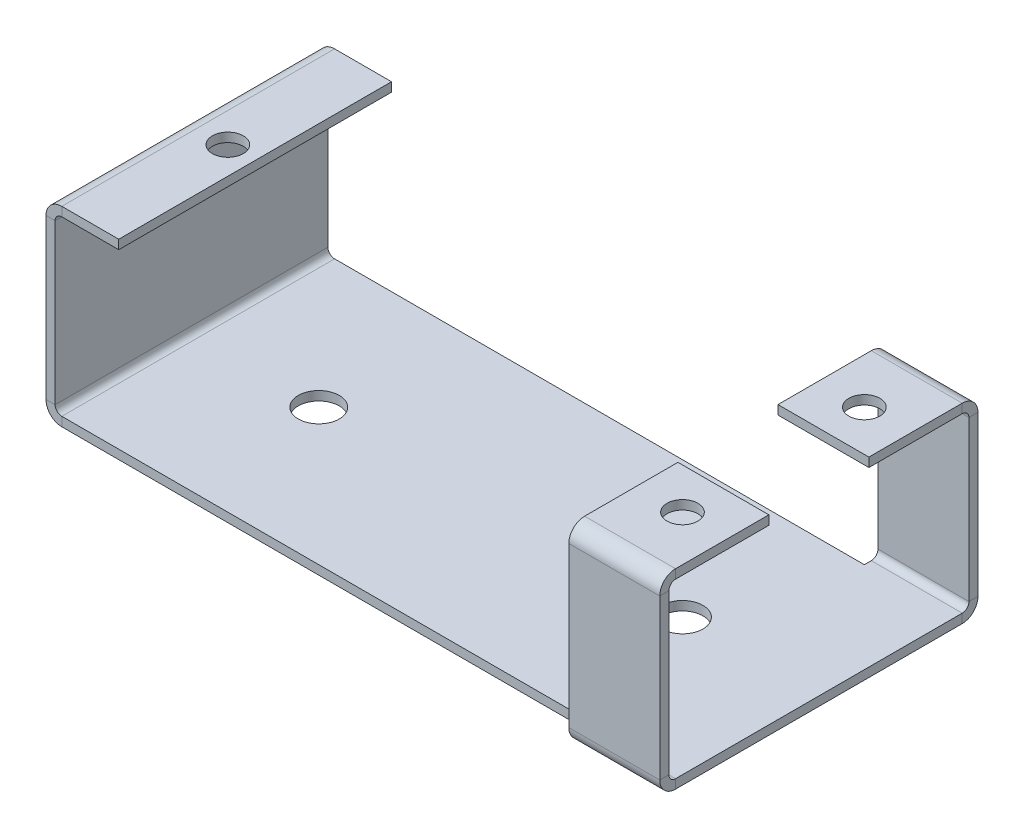
from build123d import *

# Parameters (mm, degrees)
T_LE_DE_BASE_PLI_E1_DEPTH               = 1
T_LE_PLI_E_SUR_AR_TE1_STRIP_W           = 5.4732
T_LE_PLI_E_SUR_AR_TE1_STRIP_H           = 1
T_LE_PLI_E_SUR_AR_TE1_STRIP_CUT_DEPTH   = 30
T_LE_PLI_E_SUR_AR_TE1_DEPTH             = 30
T_LE_PLI_E_SUR_AR_TE2_STRIP_W           = 5.4732
T_LE_PLI_E_SUR_AR_TE2_STRIP_H           = 1
T_LE_PLI_E_SUR_AR_TE2_STRIP_CUT_DEPTH   = 30
T_LE_PLI_E_SUR_AR_TE2_DEPTH             = 30
ENL_V_MAT_EXTRU_1_REACH                 = 46.026
ESQUISSE12_R                            = 1.7
ENL_V_MAT_EXTRU_3_REACH                 = 45.557
ESQUISSE27_R                            = 2.25
T_LE_PLI_E_SUR_AR_TE3_STRIP_W           = 5.4732
T_LE_PLI_E_SUR_AR_TE3_STRIP_H           = 1
T_LE_PLI_E_SUR_AR_TE3_STRIP_CUT_DEPTH   = 10
T_LE_PLI_E_SUR_AR_TE3_STRIP_2_W         = 5.4732
T_LE_PLI_E_SUR_AR_TE3_STRIP_2_H         = 1
T_LE_PLI_E_SUR_AR_TE3_STRIP_CUT_2_DEPTH = 10
T_LE_PLI_E_SUR_AR_TE3_DEPTH             = 10
T_LE_PLI_E_SUR_AR_TE3_BEND_DEPTH        = 10
T_LE_PLI_E_SUR_AR_TE4_STRIP_W           = 5.4732
T_LE_PLI_E_SUR_AR_TE4_STRIP_H           = 1
T_LE_PLI_E_SUR_AR_TE4_STRIP_CUT_DEPTH   = 10
T_LE_PLI_E_SUR_AR_TE4_STRIP_2_W         = 5.4732
T_LE_PLI_E_SUR_AR_TE4_STRIP_2_H         = 1
T_LE_PLI_E_SUR_AR_TE4_STRIP_CUT_2_DEPTH = 10
T_LE_PLI_E_SUR_AR_TE4_DEPTH             = 10
T_LE_PLI_E_SUR_AR_TE4_BEND_DEPTH        = 10
ENL_V_MAT_EXTRU_2_REACH                 = 46.41
ESQUISSE26_R                            = 1.7


# Sheet-metal steps are written as plain solids
with BuildPart() as part:
    # Esquisse1 → Tôle de base pliée1 (new body)
    with BuildSketch(Plane(origin=(0, 0, 0), x_dir=(1, 0, 0), z_dir=(0, 1, 0))):
        Polygon((35, -15), (35, -16.5), (25, -16.5), (25, -15), (-35, -15), (-35, 15), (25, 15), (25, 16.5), (35, 16.5), (35, 15), align=None)
    extrude(amount=T_LE_DE_BASE_PLI_E1_DEPTH)

    # Tôle pliée sur arête1 strip (across the edge) → Tôle pliée sur arête1 strip cut (cut)
    with BuildSketch(Plane(origin=(-35, 1, -15), x_dir=(1, 0, 0), z_dir=(0, 0, 1))):
        with Locations((-1, -0.5)):
            Rectangle(T_LE_PLI_E_SUR_AR_TE1_STRIP_W, T_LE_PLI_E_SUR_AR_TE1_STRIP_H)
    extrude(amount=T_LE_PLI_E_SUR_AR_TE1_STRIP_CUT_DEPTH, mode=Mode.SUBTRACT)

    # Tôle pliée sur arête1 section (across the edge) → Tôle pliée sur arête1 (add)
    with BuildSketch(Plane(origin=(-35, 1, -15), x_dir=(1, 0, 0), z_dir=(0, 0, 1))):
        with BuildLine():
            Line((0, 0.7366), (0, 20))
            Line((0, 20), (1, 20))
            Line((1, 20), (1, 0.7366))
            ThreePointArc((1, 0.7366), (1.215745145, 0.215745145), (1.7366, 0))
            Line((1.7366, 0), (1.7366, -1))
            ThreePointArc((1.7366, -1), (0.508638364, -0.491361636), (0, 0.7366))
        make_face()
    extrude(amount=T_LE_PLI_E_SUR_AR_TE1_DEPTH)

    # Tôle pliée sur arête2 strip (across the edge) → Tôle pliée sur arête2 strip cut (cut)
    with BuildSketch(Plane(origin=(-34, 21, -15), x_dir=(0, -1, 0), z_dir=(0, 0, 1))):
        with Locations((-1, -0.5)):
            Rectangle(T_LE_PLI_E_SUR_AR_TE2_STRIP_W, T_LE_PLI_E_SUR_AR_TE2_STRIP_H)
    extrude(amount=T_LE_PLI_E_SUR_AR_TE2_STRIP_CUT_DEPTH, mode=Mode.SUBTRACT)

    # Tôle pliée sur arête2 section (across the edge) → Tôle pliée sur arête2 (add)
    with BuildSketch(Plane(origin=(-34, 21, -15), x_dir=(0, -1, 0), z_dir=(0, 0, 1))):
        with BuildLine():
            Line((0, 0.7366), (0, 7))
            Line((0, 7), (1, 7))
            Line((1, 7), (1, 0.7366))
            ThreePointArc((1, 0.7366), (1.215745145, 0.215745145), (1.7366, 0))
            Line((1.7366, 0), (1.7366, -1))
            ThreePointArc((1.7366, -1), (0.508638364, -0.491361636), (0, 0.7366))
        make_face()
    extrude(amount=T_LE_PLI_E_SUR_AR_TE2_DEPTH)

    # Esquisse12 → Enlèv. mat.-Extru.1 (cut, up to next)
    with BuildSketch(Plane(origin=(0, 21, 0), x_dir=(1, 0, 0), z_dir=(0, 1, 0)), mode=Mode.PRIVATE) as enl_v_mat_extru_1_sk1:
        with Locations(Location((-30, 0, 0), (0, 0, 180))):
            Circle(ESQUISSE12_R)
    enl_v_mat_extru_1_tool1 = extrude(enl_v_mat_extru_1_sk1.sketch, amount=-ENL_V_MAT_EXTRU_1_REACH, mode=Mode.PRIVATE) & part.part
    add(enl_v_mat_extru_1_tool1.solids().sort_by_distance((-30, 21, 0))[0], mode=Mode.SUBTRACT)

    # Esquisse27 → Enlèv. mat.-Extru.3 (cut, up to next)
    with BuildSketch(Plane(origin=(0, 1, 0), x_dir=(1, 0, 0), z_dir=(0, 1, 0)), mode=Mode.PRIVATE) as enl_v_mat_extru_3_sk1:
        with Locations(Location((-20, 0, 0), (0, 0, 270))):
            Circle(ESQUISSE27_R)
    enl_v_mat_extru_3_tool1 = extrude(enl_v_mat_extru_3_sk1.sketch, amount=-ENL_V_MAT_EXTRU_3_REACH, mode=Mode.PRIVATE) & part.part
    # Esquisse27 → Enlèv. mat.-Extru.3 (cut, up to next)
    with BuildSketch(Plane(origin=(0, 1, 0), x_dir=(1, 0, 0), z_dir=(0, 1, 0)), mode=Mode.PRIVATE) as enl_v_mat_extru_3_sk2:
        with Locations(Location((20, 0, 0), (0, 0, 270))):
            Circle(ESQUISSE27_R)
    enl_v_mat_extru_3_tool2 = extrude(enl_v_mat_extru_3_sk2.sketch, amount=-ENL_V_MAT_EXTRU_3_REACH, mode=Mode.PRIVATE) & part.part
    add(enl_v_mat_extru_3_tool1.solids().sort_by_distance((-20, 1, 0))[0], mode=Mode.SUBTRACT)
    add(enl_v_mat_extru_3_tool2.solids().sort_by_distance((20, 1, 0))[0], mode=Mode.SUBTRACT)

    # Tôle pliée sur arête3 strip (across the edge) → Tôle pliée sur arête3 strip cut (cut)
    with BuildSketch(Plane(origin=(25, 1, 16.5), x_dir=(0, 0, -1), z_dir=(1, 0, 0))):
        with Locations((-2, -0.5)):
            Rectangle(T_LE_PLI_E_SUR_AR_TE3_STRIP_W, T_LE_PLI_E_SUR_AR_TE3_STRIP_H)
    extrude(amount=T_LE_PLI_E_SUR_AR_TE3_STRIP_CUT_DEPTH, mode=Mode.SUBTRACT)

    # Tôle pliée sur arête3 strip 2 (across the edge) → Tôle pliée sur arête3 strip cut 2 (cut)
    with BuildSketch(Plane(origin=(35, 1, -16.5), x_dir=(0, 0, 1), z_dir=(-1, 0, 0))):
        with Locations((-2, -0.5)):
            Rectangle(T_LE_PLI_E_SUR_AR_TE3_STRIP_2_W, T_LE_PLI_E_SUR_AR_TE3_STRIP_2_H)
    extrude(amount=T_LE_PLI_E_SUR_AR_TE3_STRIP_CUT_2_DEPTH, mode=Mode.SUBTRACT)

    # Tôle pliée sur arête3 section (across the edge) → Tôle pliée sur arête3 (add)
    with BuildSketch(Plane(origin=(25, 1, 16.5), x_dir=(0, 0, -1), z_dir=(1, 0, 0))):
        with BuildLine():
            Line((-1, 0.7366), (-1, 19))
            Line((-1, 19), (0, 19))
            Line((0, 19), (0, 0.7366))
            ThreePointArc((0, 0.7366), (0.215745145, 0.215745145), (0.7366, 0))
            Line((0.7366, 0), (0.7366, -1))
            ThreePointArc((0.7366, -1), (-0.491361636, -0.491361636), (-1, 0.7366))
        make_face()
    extrude(amount=T_LE_PLI_E_SUR_AR_TE3_DEPTH)

    # Tôle pliée sur arête3 section 2 (across the edge) → Tôle pliée sur arête3 bend (add)
    with BuildSketch(Plane(origin=(35, 1, -16.5), x_dir=(0, 0, 1), z_dir=(-1, 0, 0))):
        with BuildLine():
            Line((-1, 0.7366), (-1, 19))
            Line((-1, 19), (0, 19))
            Line((0, 19), (0, 0.7366))
            ThreePointArc((0, 0.7366), (0.215745145, 0.215745145), (0.7366, 0))
            Line((0.7366, 0), (0.7366, -1))
            ThreePointArc((0.7366, -1), (-0.491361636, -0.491361636), (-1, 0.7366))
        make_face()
    extrude(amount=T_LE_PLI_E_SUR_AR_TE3_BEND_DEPTH)

    # Tôle pliée sur arête4 strip (across the edge) → Tôle pliée sur arête4 strip cut (cut)
    with BuildSketch(Plane(origin=(25, 20, 16.5), x_dir=(0, -1, 0), z_dir=(1, 0, 0))):
        with Locations((-2, -0.5)):
            Rectangle(T_LE_PLI_E_SUR_AR_TE4_STRIP_W, T_LE_PLI_E_SUR_AR_TE4_STRIP_H)
    extrude(amount=T_LE_PLI_E_SUR_AR_TE4_STRIP_CUT_DEPTH, mode=Mode.SUBTRACT)

    # Tôle pliée sur arête4 strip 2 (across the edge) → Tôle pliée sur arête4 strip cut 2 (cut)
    with BuildSketch(Plane(origin=(35, 20, -16.5), x_dir=(0, -1, 0), z_dir=(-1, 0, 0))):
        with Locations((-2, -0.5)):
            Rectangle(T_LE_PLI_E_SUR_AR_TE4_STRIP_2_W, T_LE_PLI_E_SUR_AR_TE4_STRIP_2_H)
    extrude(amount=T_LE_PLI_E_SUR_AR_TE4_STRIP_CUT_2_DEPTH, mode=Mode.SUBTRACT)

    # Tôle pliée sur arête4 section (across the edge) → Tôle pliée sur arête4 (add)
    with BuildSketch(Plane(origin=(25, 20, 16.5), x_dir=(0, -1, 0), z_dir=(1, 0, 0))):
        with BuildLine():
            Line((-1, 0.7366), (-1, 11))
            Line((-1, 11), (0, 11))
            Line((0, 11), (0, 0.7366))
            ThreePointArc((0, 0.7366), (0.215745145, 0.215745145), (0.7366, 0))
            Line((0.7366, 0), (0.7366, -1))
            ThreePointArc((0.7366, -1), (-0.491361636, -0.491361636), (-1, 0.7366))
        make_face()
    extrude(amount=T_LE_PLI_E_SUR_AR_TE4_DEPTH)

    # Tôle pliée sur arête4 section 2 (across the edge) → Tôle pliée sur arête4 bend (add)
    with BuildSketch(Plane(origin=(35, 20, -16.5), x_dir=(0, -1, 0), z_dir=(-1, 0, 0))):
        with BuildLine():
            Line((-1, 0.7366), (-1, 11))
            Line((-1, 11), (0, 11))
            Line((0, 11), (0, 0.7366))
            ThreePointArc((0, 0.7366), (0.215745145, 0.215745145), (0.7366, 0))
            Line((0.7366, 0), (0.7366, -1))
            ThreePointArc((0.7366, -1), (-0.491361636, -0.491361636), (-1, 0.7366))
        make_face()
    extrude(amount=T_LE_PLI_E_SUR_AR_TE4_BEND_DEPTH)

    # Esquisse26 → Enlèv. mat.-Extru.2 (cut, up to next)
    with BuildSketch(Plane(origin=(0, 21, 0), x_dir=(1, 0, 0), z_dir=(0, 1, 0)), mode=Mode.PRIVATE) as enl_v_mat_extru_2_sk1:
        with Locations(Location((30, -10, 0), (0, 0, 270))):
            Circle(ESQUISSE26_R)
    enl_v_mat_extru_2_tool1 = extrude(enl_v_mat_extru_2_sk1.sketch, amount=-ENL_V_MAT_EXTRU_2_REACH, mode=Mode.PRIVATE) & part.part
    # Esquisse26 → Enlèv. mat.-Extru.2 (cut, up to next)
    with BuildSketch(Plane(origin=(0, 21, 0), x_dir=(1, 0, 0), z_dir=(0, 1, 0)), mode=Mode.PRIVATE) as enl_v_mat_extru_2_sk2:
        with Locations(Location((30, 10, 0), (0, 0, 90))):
            Circle(ESQUISSE26_R)
    enl_v_mat_extru_2_tool2 = extrude(enl_v_mat_extru_2_sk2.sketch, amount=-ENL_V_MAT_EXTRU_2_REACH, mode=Mode.PRIVATE) & part.part
    add(enl_v_mat_extru_2_tool1.solids().sort_by_distance((30, 21, 10))[0], mode=Mode.SUBTRACT)
    add(enl_v_mat_extru_2_tool2.solids().sort_by_distance((30, 21, -10))[0], mode=Mode.SUBTRACT)


solid = part.part
